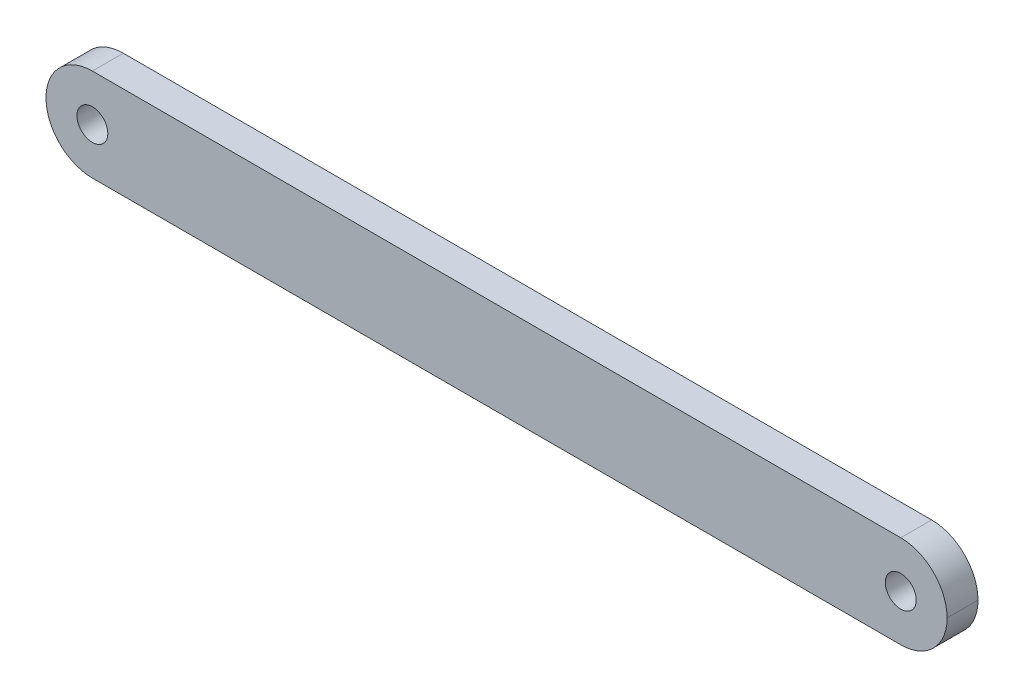
from build123d import *

# Parameters (mm, degrees)
SKETCH1_W           = 58.32
SKETCH1_H           = 6
SKETCH1_R           = 1
BOSS_EXTRUDE1_DEPTH = 2
FILLET1_R           = 3


with BuildPart() as part:
    # Sketch1 → Boss-Extrude1 (new body)
    with BuildSketch(Plane.XY):
        with Locations((29.16, 3)):
            Rectangle(SKETCH1_W, SKETCH1_H)
        with Locations((3, 3)):
            Circle(SKETCH1_R, mode=Mode.SUBTRACT)
        with Locations((55.32, 3)):
            Circle(SKETCH1_R, mode=Mode.SUBTRACT)
    extrude(amount=BOSS_EXTRUDE1_DEPTH)

    # Fillet1
    fillet1_edges = [part.edges().sort_by_distance(p)[0] for p in [
        (58.32, 0, 1),
        (58.32, 6, 1),
        (0, 0, 1),
        (0, 6, 1),
    ]]
    fillet(fillet1_edges, radius=FILLET1_R - 0.0001)  # a hair under: the kernel refuses the full size


solid = part.part
